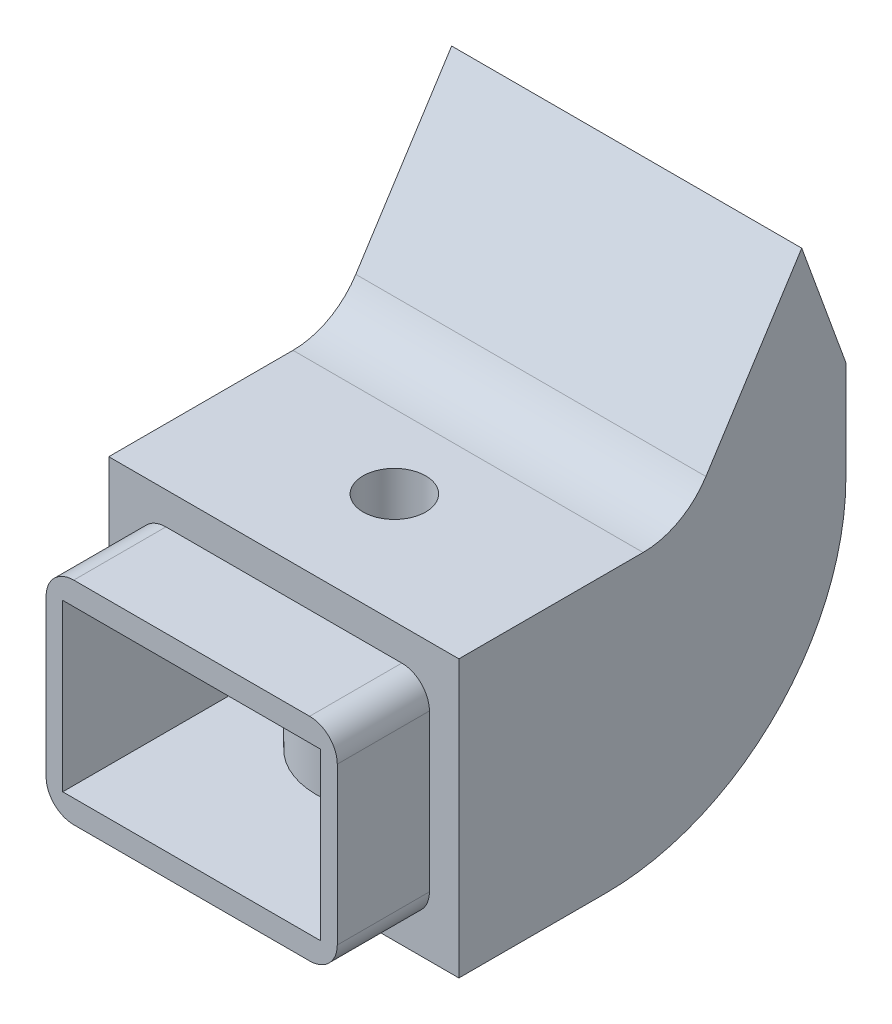
from build123d import *

# Parameters (mm, degrees)
SALIENTE_EXTRUIR1_DEPTH                              = 18
SALIENTE_EXTRUIR2_DEPTH                              = 12
CORTAR_EXTRUIR1_DEPTH                                = 17
CROQUIS4_W                                           = 16.47485784
CROQUIS4_H                                           = 9
CORTAR_EXTRUIR2_DEPTH                                = 15.5
CORTAR_EXTRUIR3_DEPTH                                = 5
CROQUIS6_W                                           = 18
CROQUIS6_H                                           = 12.211968345
CORTAR_EXTRUIR4_DEPTH                                = 27.564918354
SALIENTE_EXTRUIR3_DEPTH                              = 9
SALIENTE_EXTRUIR4_DEPTH                              = 1.25
CROQUIS9_W                                           = 18
CROQUIS9_H                                           = 21
SALIENTE_EXTRUIR5_DEPTH                              = 1.75
CROQUIS10_W                                          = 1.5
CROQUIS10_H                                          = 9
CORTAR_EXTRUIR5_DEPTH                                = 6.47485784
CROQUIS11_W                                          = 1.5
CROQUIS11_H                                          = 9
CORTAR_EXTRUIR6_DEPTH                                = 6.47485784
SALIENTE_EXTRUIR6_DEPTH                              = 1
NGULO_DE_SALIDA1_ANGLE                               = 32.6
REFRENTADO_PARA_TORNILLO_CON_CABEZA_HEXA_D           = 3.4
REFRENTADO_PARA_TORNILLO_CON_CABEZA_HEXA_DEPTH       = 24.997848167
REFRENTADO_PARA_TORNILLO_CON_CABEZA_HEXA_CBORE_D     = 6.5
REFRENTADO_PARA_TORNILLO_CON_CABEZA_HEXA_CBORE_DEPTH = 3.4
REDONDEO1_R                                          = 1.5
REDONDEO2_R                                          = 4.046592592
REDONDEO3_R                                          = 9.394473
REDONDEO4_R                                          = 10
REDONDEO5_R                                          = 13.000000028


with BuildPart() as part:
    # Croquis1 → Saliente-Extruir1 (new body)
    with BuildSketch(Plane(origin=(7.936078108, 0, 0), x_dir=(0, 0, -1), z_dir=(1, 0, 0))):
        with BuildLine():
            Line((-154.285744598, -37.213626554), (-128.285744598, -37.213626554))
            Line((-128.285744598, -37.213626554), (-128.285744598, -33.793626733))
            Line((-128.285744598, -33.793626733), (-137.073776253, -9.6487082))
            Line((-137.073776253, -9.6487082), (-149.285744598, -9.6487082))
            add(Edge.make_bspline(
                [(-154.285744598, -9.6487082), (-152.619077931, -9.6487082), (-150.952411265, -9.6487082), (-149.285744598, -9.6487082)],
                knots=[0, 0, 0, 0, 1, 1, 1, 1], degree=3))
            add(Edge.make_bspline(
                [(-154.285744598, -9.6487082), (-154.285744598, -18.837014318), (-154.285744598, -28.025320436), (-154.285744598, -37.213626554)],
                knots=[0, 0, 0, 0, 1, 1, 1, 1], degree=3))
        make_face()
    extrude(amount=-SALIENTE_EXTRUIR1_DEPTH)

    # Croquis2 → Saliente-Extruir2 (add)
    with BuildSketch(Plane.XZ.offset(37.213626554)):
        with BuildLine():
            Line((-10.063921892, 154.285744598), (7.936078108, 154.285744598))
            add(Edge.make_bspline(
                [(7.936078108, 154.285744598), (7.936078108, 152.619077931), (7.936078108, 150.952411265), (7.936078108, 149.285744598)],
                knots=[0, 0, 0, 0, 1, 1, 1, 1], degree=3))
            Line((7.936078108, 149.285744598), (7.936078108, 128.285744598))
            Line((7.936078108, 128.285744598), (-10.063921892, 128.285744598))
            Line((-10.063921892, 128.285744598), (-10.063921892, 154.285744598))
        make_face()
    extrude(amount=SALIENTE_EXTRUIR2_DEPTH)

    # Croquis3 → Cortar-Extruir1 (cut)
    with BuildSketch(Plane.ZY.offset(10.063921892)):
        Polygon((135.078487354, -49.213626554), (137.810886758, -49.213626554), (137.810886758, -40.213626554), (130.25136436, -28.393130822), (129.348598898, -30.873458543), align=None)
    extrude(amount=-CORTAR_EXTRUIR1_DEPTH, mode=Mode.SUBTRACT)

    # Croquis4 → Cortar-Extruir2 (cut)
    with BuildSketch(Plane.ZY.offset(10.063921892)):
        with Locations((146.048315678, -44.713626554)):
            Rectangle(CROQUIS4_W, CROQUIS4_H)
    extrude(amount=-CORTAR_EXTRUIR2_DEPTH, mode=Mode.SUBTRACT)

    # Croquis5 → Cortar-Extruir3 (cut)
    with BuildSketch(Plane.XY.offset(154.285744598)):
        with BuildLine():
            Line((-10.063921892, -40.213626554), (-9.463921892, -40.213626554))
            Line((-9.463921892, -40.213626554), (-9.463921892, -38.963626554))
            Line((-9.463921892, -38.963626554), (6.336078108, -38.963626554))
            Line((6.336078108, -38.963626554), (6.336078108, -49.213626554))
            Line((6.336078108, -49.213626554), (7.936078108, -49.213626554))
            Line((7.936078108, -49.213626554), (7.936078108, -37.213626554))
            add(Edge.make_bspline(
                [(7.936078108, -9.6487082), (7.936078108, -18.837014318), (7.936078108, -28.025320436), (7.936078108, -37.213626554)],
                knots=[0, 0, 0, 0, 1, 1, 1, 1], degree=3))
            Line((7.936078108, -9.6487082), (-10.063921892, -9.6487082))
            add(Edge.make_bspline(
                [(-10.063921892, -9.6487082), (-10.063921892, -18.837014318), (-10.063921892, -28.025320436), (-10.063921892, -37.213626554)],
                knots=[0, 0, 0, 0, 1, 1, 1, 1], degree=3))
            Line((-10.063921892, -37.213626554), (-10.063921892, -40.213626554))
        make_face()
    extrude(amount=-CORTAR_EXTRUIR3_DEPTH, mode=Mode.SUBTRACT)

    # Croquis6 → Cortar-Extruir4 (cut)
    with BuildSketch(Plane(origin=(0, -9.6487082, 0), x_dir=(-1, 0, 0), z_dir=(0, 1, 0))):
        with Locations((1.063921892, 143.179760426)):
            Rectangle(CROQUIS6_W, CROQUIS6_H)
    extrude(amount=-CORTAR_EXTRUIR4_DEPTH, mode=Mode.SUBTRACT)

    # Croquis7 → Saliente-Extruir3 (add)
    with BuildSketch(Plane.XZ.offset(40.213626554)):
        Polygon((-9.463921892, 154.285744598), (-8.563921892, 154.285744598), (-8.563921892, 137.810886758), (-10.063921892, 137.810886758), (-10.063921892, 149.285744598), (-9.463921892, 149.285744598), align=None)
    extrude(amount=SALIENTE_EXTRUIR3_DEPTH)

    # Croquis8 → Saliente-Extruir4 (add)
    with BuildSketch(Plane.XZ.offset(49.213626554)):
        Polygon((-9.463921892, 154.285744598), (6.336078108, 154.285744598), (6.336078108, 149.285744598), (7.936078108, 149.285744598), (7.936078108, 128.285744598), (-10.063921892, 128.285744598), (-10.063921892, 149.285744598), (-9.463921892, 149.285744598), align=None)
    extrude(amount=SALIENTE_EXTRUIR4_DEPTH)

    # Croquis9 → Saliente-Extruir5 (add)
    with BuildSketch(Plane.XZ.offset(50.463626554)):
        with Locations((-1.063921892, 138.785744598)):
            Rectangle(CROQUIS9_W, CROQUIS9_H)
    extrude(amount=SALIENTE_EXTRUIR5_DEPTH)

    # Croquis10 → Cortar-Extruir5 (cut)
    with BuildSketch(Plane(origin=(0, 0, 137.810886758), x_dir=(-1, 0, 0), z_dir=(0, 0, -1))):
        with Locations((-6.186078108, -44.713626554)):
            Rectangle(CROQUIS10_W, CROQUIS10_H)
    extrude(amount=-CORTAR_EXTRUIR5_DEPTH, mode=Mode.SUBTRACT)

    # Croquis11 → Cortar-Extruir6 (cut)
    with BuildSketch(Plane(origin=(0, 0, 137.810886758), x_dir=(-1, 0, 0), z_dir=(0, 0, -1))):
        with Locations((9.313921892, -44.713626554)):
            Rectangle(CROQUIS11_W, CROQUIS11_H)
    extrude(amount=-CORTAR_EXTRUIR6_DEPTH, mode=Mode.SUBTRACT)

    # Croquis12 → Saliente-Extruir6 (add)
    with BuildSketch(Plane.ZY.offset(10.063921892)):
        Polygon((149.285744598, -52.213626554), (128.285744598, -52.213626554), (128.285744598, -33.793626733), (137.073776253, -9.6487082), (137.073776253, -37.213626554), (149.285744598, -37.213626554), align=None)
    extrude(amount=SALIENTE_EXTRUIR6_DEPTH)

    # Ángulo de salida1
    ngulo_de_salida1_faces = [part.faces().sort_by_distance(p)[0] for p in [
        (-1.563921892, -23.431167377, 137.073776253),
    ]]
    draft(ngulo_de_salida1_faces, Plane.ZX.offset(-37.213626554), NGULO_DE_SALIDA1_ANGLE)

    # Croquis13 → Revolución1 (revolve)
    with BuildSketch(Plane(origin=(0, 0, 143.285744598), x_dir=(-1, 0, 0), z_dir=(0, 0, -1)), mode=Mode.PRIVATE) as revoluci_n1_sk:
        Polygon((-2.686078108, -49.213626554), (1.563921892, -49.213626554), (1.563921892, -40.213626554), (-1.136078108, -40.213626554), (-1.136078108, -46.813626554), (-2.686078108, -46.813626554), align=None)
    revolve(revoluci_n1_sk.sketch.rotate(Axis((-1.563921892, -49.213626554, 143.285744598), (0, 1, 0)), 270), axis=Axis((-1.563921892, -49.213626554, 143.285744598), (0, 1, 0)))

    # Refrentado para tornillo con cabeza hexagonal de M31
    with Locations(Plane(origin=(0, -52.213626554, 0), x_dir=(-1, 0, 0), z_dir=(0, -1, 0))):
        with Locations((1.563921892, -143.285744598)):
            CounterBoreHole(REFRENTADO_PARA_TORNILLO_CON_CABEZA_HEXA_D / 2, REFRENTADO_PARA_TORNILLO_CON_CABEZA_HEXA_CBORE_D / 2, REFRENTADO_PARA_TORNILLO_CON_CABEZA_HEXA_CBORE_DEPTH, depth=REFRENTADO_PARA_TORNILLO_CON_CABEZA_HEXA_DEPTH)

    # Redondeo1
    redondeo1_edges = [part.edges().sort_by_distance(p)[0] for p in [
        (6.336078108, -50.463626554, 151.785744598),
        (6.336078108, -38.963626554, 151.785744598),
        (-9.463921892, -50.463626554, 151.785744598),
        (-9.463921892, -38.963626554, 151.785744598),
    ]]
    fillet(redondeo1_edges, radius=REDONDEO1_R)

    # Redondeo2
    redondeo2_edges = [part.edges().sort_by_distance(p)[0] for p in [
        (-1.563921892, -37.213626554, 137.073776253),
    ]]
    fillet(redondeo2_edges, radius=REDONDEO2_R)

    # Redondeo3
    # the kernel refuses this fillet: 9.394473 mm, written as the material it adds along each edge
    with BuildSketch(Plane(origin=(-10.063921892, -49.213626554, 135.078487354), x_dir=(0, 0.954500927456638, -0.2982079467157403), z_dir=(1, 0, 0))) as redondeo3_piece_1_section:
        with BuildLine():
            CenterArc((REDONDEO3_R * 0.735245019776, REDONDEO3_R), REDONDEO3_R, 197.35, 72.65)
            Line((-REDONDEO3_R * 0.21925590768, REDONDEO3_R * 0.701792053284), (0, 0))
            Line((0, 0), (REDONDEO3_R * 0.735245019776, 0))
        make_face()
    redondeo3_piece_1 = extrude(amount=17, mode=Mode.PRIVATE)
    redondeo3_piece_1 = redondeo3_piece_1 - Plane(origin=(-1.563921892, -47.780974958, 143.285744598), x_dir=(0, 0, 1), z_dir=(0, -1, 0)) * Cylinder(4.25, 62, mode=Mode.PRIVATE)
    add(redondeo3_piece_1)

    # Redondeo4
    # the kernel refuses this fillet: 10 mm, written as the material it takes off along each edge
    with BuildSketch(Plane(origin=(6.936078108, -40.213626554, 137.810886758), x_dir=(-2.541450920679997e-12, 0, 1.0), z_dir=(-1.0, -2.5749151914609573e-12, -2.5414509206799975e-12))) as redondeo4_piece_1_section:
        with BuildLine():
            CenterArc((REDONDEO4_R * 0.547484008153, REDONDEO4_R), REDONDEO4_R, 212.6, 57.4)
            Line((-REDONDEO4_R * 0.294968388853, REDONDEO4_R * 0.461229214991), (0, 0))
            Line((0, 0), (REDONDEO4_R * 0.547484008153, 0))
        make_face()
    redondeo4_piece_1 = extrude(amount=15.5, mode=Mode.PRIVATE)
    redondeo4_piece_1 = redondeo4_piece_1 - Plane(origin=(-1.563921892, -39.236985305, 143.285744598), x_dir=(0, 0, 1), z_dir=(0, -1, 0)) * Cylinder(2.7, 53, mode=Mode.PRIVATE)
    add(redondeo4_piece_1, mode=Mode.SUBTRACT)
    with BuildSketch(Plane(origin=(-10.063921892, -40.213626554, 137.810886758), x_dir=(0, 0, 1), z_dir=(1, 0, 0))) as redondeo4_piece_2:
        with BuildLine():
            CenterArc((REDONDEO4_R * 0.547484008153, -REDONDEO4_R), REDONDEO4_R, 90, 57.4)
            Line((-REDONDEO4_R * 0.294968388853, -REDONDEO4_R * 0.461229214991), (0, 0))
            Line((0, 0), (REDONDEO4_R * 0.547484008153, 0))
        make_face()
    extrude(amount=1.5, mode=Mode.SUBTRACT)

    # Redondeo5
    # the kernel refuses this fillet: 13.000000028 mm, written as the material it takes off along each edge
    with BuildSketch(Plane(origin=(40.436078177, -52.213626554, 128.285744598), x_dir=(0, 1, 0), z_dir=(-1, 0, 0))) as redondeo5_piece_1:
        with BuildLine():
            CenterArc((REDONDEO5_R, -REDONDEO5_R), REDONDEO5_R, 90, 90)
            Line((0, -REDONDEO5_R), (0, 0))
            Line((0, 0), (REDONDEO5_R, 0))
        make_face()
    extrude(amount=84.000000138, mode=Mode.SUBTRACT)


solid = part.part
